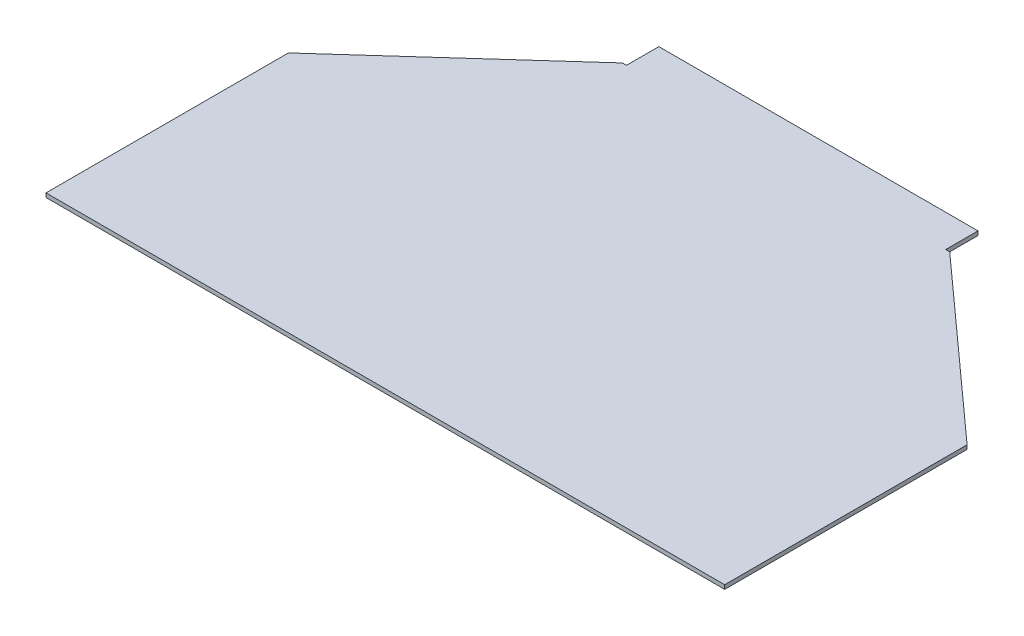
from build123d import *

# Parameters (mm, degrees)
BASE_FLANGE1_DEPTH = 3.175


# Sheet-metal steps are written as plain solids
with BuildPart() as part:
    # Sketch1 → Base-Flange1 (new body)
    with BuildSketch(Plane(origin=(0, 0, 0), x_dir=(1, 0, 0), z_dir=(0, 1, 0))):
        Polygon((125.4125, 0), (-125.4125, 0), (-125.4125, -25.4), (-128.5875, -25.4), (-266.7, -149.86), (-266.7, -340.36), (266.7, -340.36), (266.7, -149.86), (128.5875, -25.4), (125.4125, -25.4), align=None)
    extrude(amount=-BASE_FLANGE1_DEPTH)


solid = part.part
